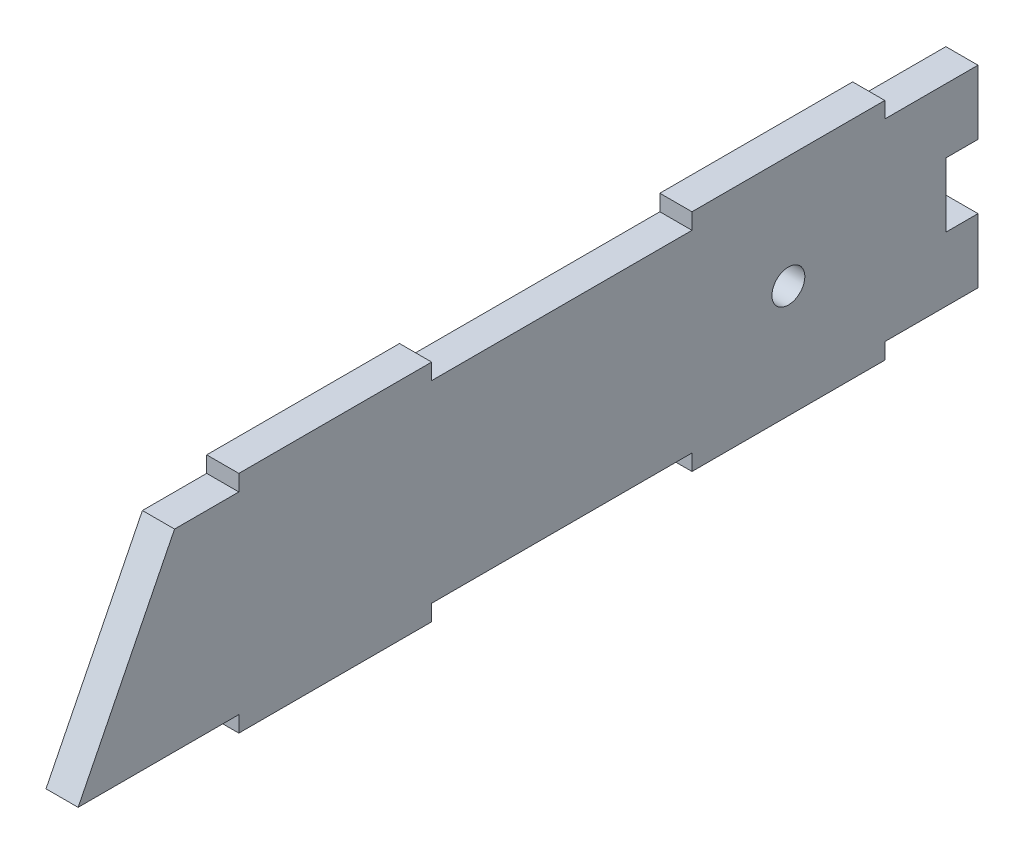
from build123d import *

# Parameters (mm, degrees)
SKETCH1_W               = 355.6
SKETCH1_H               = 76.2
BOSS_EXTRUDE1_DEPTH     = 12.7
CUT_EXTRUDE1_DEPTH      = 183.279291199
CUT_EXTRUDE1_DEPTH_BACK = 183.279291199
SKETCH3_W               = 76.2
SKETCH3_H               = 6.35
BOSS_EXTRUDE2_DEPTH     = 12.7
SKETCH4_W               = 12.7
SKETCH4_H               = 25.4
CUT_EXTRUDE2_DEPTH      = 184.711546997
SKETCH5_R               = 6.5
CUT_EXTRUDE3_DEPTH      = 184.711546997


with BuildPart() as part:
    # Sketch1 → Boss-Extrude1 (new body)
    with BuildSketch(Plane(origin=(0, 0, 0), x_dir=(0, 0, -1), z_dir=(1, 0, 0))):
        Rectangle(SKETCH1_W, SKETCH1_H)
    extrude(amount=BOSS_EXTRUDE1_DEPTH)

    # Sketch2 → Cut-Extrude1 (cut, two sides: drawn at the far end of the back side and taken through both)
    with BuildSketch(Plane(origin=(12.7, 0, 0), x_dir=(0, 0, -1), z_dir=(1, 0, 0)).offset(-CUT_EXTRUDE1_DEPTH_BACK)):
        Polygon((-507.550847217, -697.601694433), (-177.8, -38.1), (-139.7, 38.1), (190.050847217, 697.601694433), (-1128.95254165, 1357.103388866), (-1826.554236083, -38.1), align=None)
    extrude(amount=CUT_EXTRUDE1_DEPTH + CUT_EXTRUDE1_DEPTH_BACK, mode=Mode.SUBTRACT)

    # Sketch3 → Boss-Extrude2 (add)
    with BuildSketch(Plane.ZY):
        with Locations((-102.87, -41.275)):
            Rectangle(SKETCH3_W, SKETCH3_H)
        with Locations((76.2, -41.275)):
            Rectangle(SKETCH3_W, SKETCH3_H)
        with Locations((-102.87, 41.275)):
            Rectangle(SKETCH3_W, SKETCH3_H)
        with Locations((76.2, 41.275)):
            Rectangle(SKETCH3_W, SKETCH3_H)
    extrude(amount=-BOSS_EXTRUDE2_DEPTH)

    # Sketch4 → Cut-Extrude2 (cut, through all)
    with BuildSketch(Plane.ZY):
        with Locations((-171.45, 0)):
            Rectangle(SKETCH4_W, SKETCH4_H)
    extrude(amount=-CUT_EXTRUDE2_DEPTH, mode=Mode.SUBTRACT)

    # Sketch5 → Cut-Extrude3 (cut, through all)
    with BuildSketch(Plane.ZY):
        with Locations((-102.87, 0)):
            Circle(SKETCH5_R)
    extrude(amount=-CUT_EXTRUDE3_DEPTH, mode=Mode.SUBTRACT)


solid = part.part
